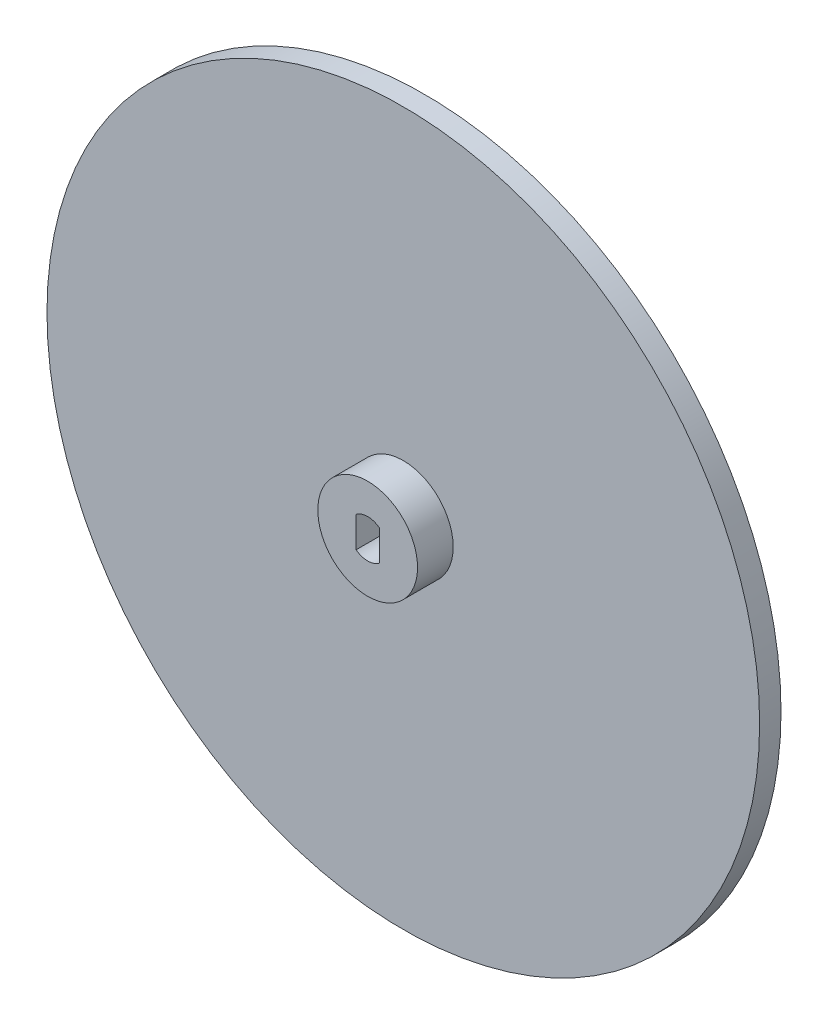
from build123d import *

# Parameters (mm, degrees)
SKETCH1_R                = 50
BOSS_EXTRUDE1_DEPTH      = 3
SKETCH2_R                = 7
BOSS_EXTRUDE2_DEPTH      = 5
CUT_EXTRUDE1_DEPTH       = 5
SKETCH4_R                = 2
CUT_EXTRUDE2_DEPTH       = 1.5
FILLET1_R                = 2
CIRPATTERN4_COUNT        = 16
FILLET1_OF_CIRPATTERN4_R = 2


with BuildPart() as part:
    # Sketch1 → Boss-Extrude1 (new body)
    with BuildSketch(Plane.XY):
        Circle(SKETCH1_R)
    extrude(amount=-BOSS_EXTRUDE1_DEPTH)

    # Sketch2 → Boss-Extrude2 (add)
    with BuildSketch(Plane.XY):
        Circle(SKETCH2_R)
    extrude(amount=BOSS_EXTRUDE2_DEPTH)

    # Sketch3 → Cut-Extrude1 (cut)
    with BuildSketch(Plane.XY.offset(5)):
        with BuildLine():
            Line((-1.625, 2.156240942), (-1.625, -2.156240942))
            ThreePointArc((-1.625, -2.156240942), (0, -2.7), (1.625, -2.156240942))
            Line((1.625, -2.156240942), (1.625, 2.156240942))
            ThreePointArc((1.625, 2.156240942), (0, 2.7), (-1.625, 2.156240942))
        make_face()
    extrude(amount=-CUT_EXTRUDE1_DEPTH, mode=Mode.SUBTRACT)

    # Sketch4 → Cut-Extrude2 (cut)
    with BuildSketch(Plane(origin=(0, 0, -3), x_dir=(-1, 0, 0), z_dir=(0, 0, -1))):
        with Locations((0, 44.850000011)):
            Circle(SKETCH4_R)
    cut_extrude2 = extrude(amount=-CUT_EXTRUDE2_DEPTH, mode=Mode.SUBTRACT)

    # Fillet1
    # the kernel refuses this fillet: 2 mm, written as the material it adds along each edge
    with BuildSketch(Plane(origin=(0, 44.850000011, -1.5), x_dir=(-1, 0, 0), z_dir=(0, -1, 0))) as fillet1_piece_1:
        with BuildLine():
            CenterArc((0.063508327, 2), FILLET1_R, 270, 75.522487814)
            Line((0.063508327, 0), (0.063508327, -0.04))
            Line((0.063508327, -0.04), (2, -0.04))
            Line((2, -0.04), (2.04, 0))
            ThreePointArc((2.04, 0), (2.04, 0.75), (2.038729833, 1.49))
            Line((2.038729833, 1.49), (2, 1.5))
        make_face()
    revolve(axis=Axis((0, 44.850000011, -1.5), (0, 0, -1)))

    # CirPattern4: Cut-Extrude2 ×16 about axis
    cirpattern4_axis = Axis((0, 0, 0), (0, 0, 1))
    for i in range(1, CIRPATTERN4_COUNT):
        add(cut_extrude2.rotate(cirpattern4_axis, i * 360 / CIRPATTERN4_COUNT), mode=Mode.SUBTRACT)

    # Fillet1 of CirPattern4
    # the kernel refuses this fillet: 2 mm, written as the material it adds along each edge
    with BuildSketch(Plane(origin=(-17.163351946, 41.435997043, -1.5), x_dir=(-0.9238795325112861, -0.3826834323650914, 0), z_dir=(0.3826834323650914, -0.9238795325112861, 0))) as fillet1_of_cirpattern4_piece_1:
        with BuildLine():
            CenterArc((0.063508327, 2), FILLET1_OF_CIRPATTERN4_R, 270, 75.522487814)
            Line((0.063508327, 0), (0.063508327, -0.04))
            Line((0.063508327, -0.04), (2, -0.04))
            Line((2, -0.04), (2.04, 0))
            ThreePointArc((2.04, 0), (2.04, 0.75), (2.038729833, 1.49))
            Line((2.038729833, 1.49), (2, 1.5))
        make_face()
    revolve(axis=Axis((-17.163351946, 41.435997043, -1.5), (0, 0, -1)))
    with BuildSketch(Plane(origin=(-31.713739144, 31.713739144, -1.5), x_dir=(-0.7071067811865467, -0.7071067811865485, 0), z_dir=(0.7071067811865485, -0.7071067811865467, 0))) as fillet1_of_cirpattern4_piece_2:
        with BuildLine():
            CenterArc((0.063508327, 2), FILLET1_OF_CIRPATTERN4_R, 270, 75.522487814)
            Line((0.063508327, 0), (0.063508327, -0.04))
            Line((0.063508327, -0.04), (2, -0.04))
            Line((2, -0.04), (2.04, 0))
            ThreePointArc((2.04, 0), (2.04, 0.75), (2.038729833, 1.49))
            Line((2.038729833, 1.49), (2, 1.5))
        make_face()
    revolve(axis=Axis((-31.713739144, 31.713739144, -1.5), (0, 0, -1)))
    with BuildSketch(Plane(origin=(-41.435997043, 17.163351946, -1.5), x_dir=(-0.3826834323650911, -0.9238795325112863, 0), z_dir=(0.9238795325112863, -0.3826834323650911, 0))) as fillet1_of_cirpattern4_piece_3:
        with BuildLine():
            CenterArc((0.063508327, 2), FILLET1_OF_CIRPATTERN4_R, 270, 75.522487814)
            Line((0.063508327, 0), (0.063508327, -0.04))
            Line((0.063508327, -0.04), (2, -0.04))
            Line((2, -0.04), (2.04, 0))
            ThreePointArc((2.04, 0), (2.04, 0.75), (2.038729833, 1.49))
            Line((2.038729833, 1.49), (2, 1.5))
        make_face()
    revolve(axis=Axis((-41.435997043, 17.163351946, -1.5), (0, 0, -1)))
    with BuildSketch(Plane(origin=(-44.850000011, 0, -1.5), x_dir=(0, -1, 0), z_dir=(1, 0, 0))) as fillet1_of_cirpattern4_piece_4:
        with BuildLine():
            CenterArc((0.063508327, 2), FILLET1_OF_CIRPATTERN4_R, 270, 75.522487814)
            Line((0.063508327, 0), (0.063508327, -0.04))
            Line((0.063508327, -0.04), (2, -0.04))
            Line((2, -0.04), (2.04, 0))
            ThreePointArc((2.04, 0), (2.04, 0.75), (2.038729833, 1.49))
            Line((2.038729833, 1.49), (2, 1.5))
        make_face()
    revolve(axis=Axis((-44.850000011, 0, -1.5), (0, 0, -1)))
    with BuildSketch(Plane(origin=(-41.435997043, -17.163351946, -1.5), x_dir=(0.3826834323650914, -0.9238795325112861, 0), z_dir=(0.9238795325112861, 0.3826834323650914, 0))) as fillet1_of_cirpattern4_piece_5:
        with BuildLine():
            CenterArc((0.063508327, 2), FILLET1_OF_CIRPATTERN4_R, 270, 75.522487814)
            Line((0.063508327, 0), (0.063508327, -0.04))
            Line((0.063508327, -0.04), (2, -0.04))
            Line((2, -0.04), (2.04, 0))
            ThreePointArc((2.04, 0), (2.04, 0.75), (2.038729833, 1.49))
            Line((2.038729833, 1.49), (2, 1.5))
        make_face()
    revolve(axis=Axis((-41.435997043, -17.163351946, -1.5), (0, 0, -1)))
    with BuildSketch(Plane(origin=(-31.713739144, -31.713739144, -1.5), x_dir=(0.7071067811865485, -0.7071067811865467, 0), z_dir=(0.7071067811865467, 0.7071067811865485, 0))) as fillet1_of_cirpattern4_piece_6:
        with BuildLine():
            CenterArc((0.063508327, 2), FILLET1_OF_CIRPATTERN4_R, 270, 75.522487814)
            Line((0.063508327, 0), (0.063508327, -0.04))
            Line((0.063508327, -0.04), (2, -0.04))
            Line((2, -0.04), (2.04, 0))
            ThreePointArc((2.04, 0), (2.04, 0.75), (2.038729833, 1.49))
            Line((2.038729833, 1.49), (2, 1.5))
        make_face()
    revolve(axis=Axis((-31.713739144, -31.713739144, -1.5), (0, 0, -1)))
    with BuildSketch(Plane(origin=(-17.163351946, -41.435997043, -1.5), x_dir=(0.9238795325112863, -0.3826834323650911, 0), z_dir=(0.3826834323650911, 0.9238795325112863, 0))) as fillet1_of_cirpattern4_piece_7:
        with BuildLine():
            CenterArc((0.063508327, 2), FILLET1_OF_CIRPATTERN4_R, 270, 75.522487814)
            Line((0.063508327, 0), (0.063508327, -0.04))
            Line((0.063508327, -0.04), (2, -0.04))
            Line((2, -0.04), (2.04, 0))
            ThreePointArc((2.04, 0), (2.04, 0.75), (2.038729833, 1.49))
            Line((2.038729833, 1.49), (2, 1.5))
        make_face()
    revolve(axis=Axis((-17.163351946, -41.435997043, -1.5), (0, 0, -1)))
    with BuildSketch(Plane(origin=(0, -44.850000011, -1.5), x_dir=(1, 0, 0), z_dir=(0, 1, 0))) as fillet1_of_cirpattern4_piece_8:
        with BuildLine():
            CenterArc((0.063508327, 2), FILLET1_OF_CIRPATTERN4_R, 270, 75.522487814)
            Line((0.063508327, 0), (0.063508327, -0.04))
            Line((0.063508327, -0.04), (2, -0.04))
            Line((2, -0.04), (2.04, 0))
            ThreePointArc((2.04, 0), (2.04, 0.75), (2.038729833, 1.49))
            Line((2.038729833, 1.49), (2, 1.5))
        make_face()
    revolve(axis=Axis((0, -44.850000011, -1.5), (0, 0, -1)))
    with BuildSketch(Plane(origin=(17.163351946, -41.435997043, -1.5), x_dir=(0.9238795325112864, 0.3826834323650908, 0), z_dir=(-0.3826834323650908, 0.9238795325112864, 0))) as fillet1_of_cirpattern4_piece_9:
        with BuildLine():
            CenterArc((0.063508327, 2), FILLET1_OF_CIRPATTERN4_R, 270, 75.522487814)
            Line((0.063508327, 0), (0.063508327, -0.04))
            Line((0.063508327, -0.04), (2, -0.04))
            Line((2, -0.04), (2.04, 0))
            ThreePointArc((2.04, 0), (2.04, 0.75), (2.038729833, 1.49))
            Line((2.038729833, 1.49), (2, 1.5))
        make_face()
    revolve(axis=Axis((17.163351946, -41.435997043, -1.5), (0, 0, -1)))
    with BuildSketch(Plane(origin=(31.713739144, -31.713739144, -1.5), x_dir=(0.7071067811865467, 0.7071067811865485, 0), z_dir=(-0.7071067811865485, 0.7071067811865467, 0))) as fillet1_of_cirpattern4_piece_10:
        with BuildLine():
            CenterArc((0.063508327, 2), FILLET1_OF_CIRPATTERN4_R, 270, 75.522487814)
            Line((0.063508327, 0), (0.063508327, -0.04))
            Line((0.063508327, -0.04), (2, -0.04))
            Line((2, -0.04), (2.04, 0))
            ThreePointArc((2.04, 0), (2.04, 0.75), (2.038729833, 1.49))
            Line((2.038729833, 1.49), (2, 1.5))
        make_face()
    revolve(axis=Axis((31.713739144, -31.713739144, -1.5), (0, 0, -1)))
    with BuildSketch(Plane(origin=(41.435997043, -17.163351946, -1.5), x_dir=(0.3826834323650908, 0.9238795325112864, 0), z_dir=(-0.9238795325112864, 0.3826834323650908, 0))) as fillet1_of_cirpattern4_piece_11:
        with BuildLine():
            CenterArc((0.063508327, 2), FILLET1_OF_CIRPATTERN4_R, 270, 75.522487814)
            Line((0.063508327, 0), (0.063508327, -0.04))
            Line((0.063508327, -0.04), (2, -0.04))
            Line((2, -0.04), (2.04, 0))
            ThreePointArc((2.04, 0), (2.04, 0.75), (2.038729833, 1.49))
            Line((2.038729833, 1.49), (2, 1.5))
        make_face()
    revolve(axis=Axis((41.435997043, -17.163351946, -1.5), (0, 0, -1)))
    with BuildSketch(Plane(origin=(44.850000011, 0, -1.5), x_dir=(0, 1, 0), z_dir=(-1, 0, 0))) as fillet1_of_cirpattern4_piece_12:
        with BuildLine():
            CenterArc((0.063508327, 2), FILLET1_OF_CIRPATTERN4_R, 270, 75.522487814)
            Line((0.063508327, 0), (0.063508327, -0.04))
            Line((0.063508327, -0.04), (2, -0.04))
            Line((2, -0.04), (2.04, 0))
            ThreePointArc((2.04, 0), (2.04, 0.75), (2.038729833, 1.49))
            Line((2.038729833, 1.49), (2, 1.5))
        make_face()
    revolve(axis=Axis((44.850000011, 0, -1.5), (0, 0, -1)))
    with BuildSketch(Plane(origin=(41.435997043, 17.163351946, -1.5), x_dir=(-0.3826834323650914, 0.9238795325112861, 0), z_dir=(-0.9238795325112861, -0.3826834323650914, 0))) as fillet1_of_cirpattern4_piece_13:
        with BuildLine():
            CenterArc((0.063508327, 2), FILLET1_OF_CIRPATTERN4_R, 270, 75.522487814)
            Line((0.063508327, 0), (0.063508327, -0.04))
            Line((0.063508327, -0.04), (2, -0.04))
            Line((2, -0.04), (2.04, 0))
            ThreePointArc((2.04, 0), (2.04, 0.75), (2.038729833, 1.49))
            Line((2.038729833, 1.49), (2, 1.5))
        make_face()
    revolve(axis=Axis((41.435997043, 17.163351946, -1.5), (0, 0, -1)))
    with BuildSketch(Plane(origin=(31.713739144, 31.713739144, -1.5), x_dir=(-0.7071067811865485, 0.7071067811865467, 0), z_dir=(-0.7071067811865467, -0.7071067811865485, 0))) as fillet1_of_cirpattern4_piece_14:
        with BuildLine():
            CenterArc((0.063508327, 2), FILLET1_OF_CIRPATTERN4_R, 270, 75.522487814)
            Line((0.063508327, 0), (0.063508327, -0.04))
            Line((0.063508327, -0.04), (2, -0.04))
            Line((2, -0.04), (2.04, 0))
            ThreePointArc((2.04, 0), (2.04, 0.75), (2.038729833, 1.49))
            Line((2.038729833, 1.49), (2, 1.5))
        make_face()
    revolve(axis=Axis((31.713739144, 31.713739144, -1.5), (0, 0, -1)))
    with BuildSketch(Plane(origin=(17.163351946, 41.435997043, -1.5), x_dir=(-0.9238795325112864, 0.3826834323650908, 0), z_dir=(-0.3826834323650908, -0.9238795325112864, 0))) as fillet1_of_cirpattern4_piece_15:
        with BuildLine():
            CenterArc((0.063508327, 2), FILLET1_OF_CIRPATTERN4_R, 270, 75.522487814)
            Line((0.063508327, 0), (0.063508327, -0.04))
            Line((0.063508327, -0.04), (2, -0.04))
            Line((2, -0.04), (2.04, 0))
            ThreePointArc((2.04, 0), (2.04, 0.75), (2.038729833, 1.49))
            Line((2.038729833, 1.49), (2, 1.5))
        make_face()
    revolve(axis=Axis((17.163351946, 41.435997043, -1.5), (0, 0, -1)))


solid = part.part
